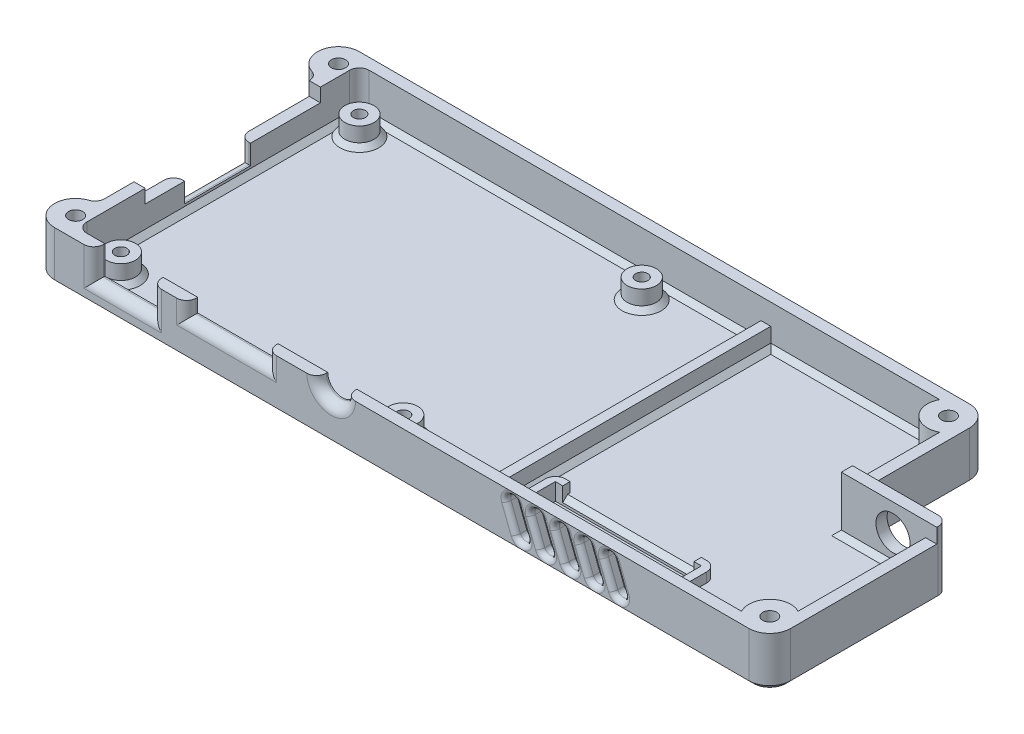
from build123d import *

# Parameters (mm, degrees)
BOSS_EXTRUDE1_DEPTH            = 10.3
BOSS_EXTRUDE2_DEPTH            = 2
SKETCH6_R                      = 3
BOSS_EXTRUDE3_DEPTH            = 4
F_2_5_2_5_DIAMETER_HOLE1_D     = 2.5
F_2_5_2_5_DIAMETER_HOLE1_DEPTH = 8
F_2_5_2_5_DIAMETER_HOLE1_TIP   = 0.751075774
SKETCH10_W                     = 2
SKETCH10_H                     = 58
BOSS_EXTRUDE4_DEPTH            = 4
CUT_EXTRUDE1_REACH             = 100.128
SKETCH11_R                     = 3
SKETCH11_W                     = 12
SKETCH11_H                     = 5.8
SKETCH11_W_2                   = 16.5
SKETCH11_H_2                   = 2.8
CUT_EXTRUDE2_REACH             = 153.227
SKETCH12_W                     = 13.5
SKETCH12_H                     = 6.8
SKETCH12_W_2                   = 36
SKETCH12_H_2                   = 2.8
FILLET6_R                      = 2
FILLET8_R                      = 2
CHAMFER1_SIZE                  = 1
FILLET9_R                      = 2
SKETCH14_W                     = 19.6
SKETCH14_H                     = 2.3
BOSS_EXTRUDE5_DEPTH            = 3
CUT_EXTRUDE3_REACH             = 86.384
SKETCH13_R                     = 3.5
BOSS_EXTRUDE6_DEPTH            = 10.3
F_2_9_2_9_DIAMETER_HOLE2_D     = 2.9
F_2_9_2_9_DIAMETER_HOLE1_D     = 2.9
BOSS_EXTRUDE7_REACH            = 89.052
SKETCH24_R                     = 4.3
F_2_9_2_9_DIAMETER_HOLE3_D     = 2.9
F_2_9_2_9_DIAMETER_HOLE4_D     = 2.9
FILLET10_R                     = 4.3
FILLET16_R                     = 4.3
FILLET17_R                     = 2
FILLET18_R                     = 2
FILLET19_R                     = 2
SKETCH29_W                     = 30.1
SKETCH29_H                     = 10.25
CUT_EXTRUDE4_DEPTH             = 1.5
CUT_EXTRUDE4_DIRECTION_2_REACH = 89.052
BOSS_EXTRUDE8_DEPTH            = 2
CHAMFER3_SIZE                  = 1
FILLET20_R                     = 2
CUT_EXTRUDE5_REACH             = 103.795
CHAMFER5_SIZE                  = 1
FILLET21_R                     = 1


# Some blends are built 0.0001 mm under size
with BuildPart() as part:
    # Sketch3 → Boss-Extrude1 (new body)
    with BuildSketch(Plane(origin=(0, 0, 0), x_dir=(1, 0, 0), z_dir=(0, 1, 0))):
        Polygon((54.738233838, 8.405993834), (72.038233838, 8.405993834), (72.038233838, -28.194006166), (54.738233838, -28.194006166), (-74.861766162, -28.194006166), (-74.861766162, 34.405993834), (54.738233838, 34.405993834), align=None)
        Polygon((57.038233838, -25.894006166), (69.738233838, -25.894006166), (69.738233838, 6.105993834), (52.438233838, 6.105993834), (52.438233838, 32.105993834), (-72.561766162, 32.105993834), (-72.561766162, -25.894006166), (52.438233838, -25.894006166), align=None, mode=Mode.SUBTRACT)
    extrude(amount=BOSS_EXTRUDE1_DEPTH)

    # Sketch5 → Boss-Extrude2 (add)
    with BuildSketch(Plane(origin=(0, 0, 0), x_dir=(1, 0, 0), z_dir=(0, 1, 0))):
        Polygon((-72.561766162, 32.105993834), (52.438233838, 32.105993834), (52.438233838, 6.105993834), (69.738233838, 6.105993834), (69.738233838, -25.894006166), (50.438233838, -25.894006166), (-72.561766162, -25.894006166), align=None)
    extrude(amount=BOSS_EXTRUDE2_DEPTH)

    # Sketch6 → Boss-Extrude3 (add)
    with BuildSketch(Plane(origin=(0, 2, 0), x_dir=(1, 0, 0), z_dir=(0, 1, 0))):
        with Locations(Location((-68.061766162, 27.605993834, 0), (0, 0, 270))):
            Circle(SKETCH6_R)
        with Locations(Location((-68.061766162, -21.394006166, 0), (0, 0, 270))):
            Circle(SKETCH6_R)
        with Locations(Location((-10.061766162, -21.394006166, 0), (0, 0, 270))):
            Circle(SKETCH6_R)
        with Locations(Location((-10.061766162, 27.605993834, 0), (0, 0, 270))):
            Circle(SKETCH6_R)
    extrude(amount=BOSS_EXTRUDE3_DEPTH)

    # Ø2.5 (2.5) Diameter Hole1
    with Locations(Plane(origin=(0, 6, 0), x_dir=(1, 0, 0), z_dir=(0, 1, 0))):
        with Locations((-68.061766162, 27.605993834), (-10.061766162, 27.605993834), (-10.061766162, -21.394006166), (-68.061766162, -21.394006166)):
            Hole(F_2_5_2_5_DIAMETER_HOLE1_D / 2, depth=F_2_5_2_5_DIAMETER_HOLE1_DEPTH)
            with Locations((0, 0, -(F_2_5_2_5_DIAMETER_HOLE1_DEPTH + F_2_5_2_5_DIAMETER_HOLE1_TIP / 2))):  # 118° drill point
                Cone(0, F_2_5_2_5_DIAMETER_HOLE1_D / 2, F_2_5_2_5_DIAMETER_HOLE1_TIP, mode=Mode.SUBTRACT)

    # Sketch10 → Boss-Extrude4 (add)
    with BuildSketch(Plane(origin=(0, 2, 0), x_dir=(1, 0, 0), z_dir=(0, 1, 0))):
        with Locations((10.938233838, 3.105993834)):
            Rectangle(SKETCH10_W, SKETCH10_H)
    extrude(amount=BOSS_EXTRUDE4_DEPTH)

    # Sketch11 → Cut-Extrude1 (cut, up to next)
    with BuildSketch(Plane.XY.offset(28.194006166), mode=Mode.PRIVATE) as cut_extrude1_sk1:
        with Locations((-18.061766162, 10.3)):
            Circle(SKETCH11_R)
    cut_extrude1_tool1 = extrude(cut_extrude1_sk1.sketch, amount=-CUT_EXTRUDE1_REACH, mode=Mode.PRIVATE) & part.part
    # Sketch11 → Cut-Extrude1 (cut, up to next)
    with BuildSketch(Plane.XY.offset(28.194006166), mode=Mode.PRIVATE) as cut_extrude1_sk2:
        with Locations((-60.861766162, 7.4)):
            Rectangle(SKETCH11_W, SKETCH11_H)
    cut_extrude1_tool2 = extrude(cut_extrude1_sk2.sketch, amount=-CUT_EXTRUDE1_REACH, mode=Mode.PRIVATE) & part.part
    # Sketch11 → Cut-Extrude1 (cut, up to next)
    with BuildSketch(Plane.XY.offset(28.194006166), mode=Mode.PRIVATE) as cut_extrude1_sk3:
        with Locations((-39.527982648, 8.9)):
            Rectangle(SKETCH11_W_2, SKETCH11_H_2)
    cut_extrude1_tool3 = extrude(cut_extrude1_sk3.sketch, amount=-CUT_EXTRUDE1_REACH, mode=Mode.PRIVATE) & part.part
    add(cut_extrude1_tool1.solids().sort_by_distance((-18.061766, 10.3, 28.194006))[0], mode=Mode.SUBTRACT)
    add(cut_extrude1_tool2.solids().sort_by_distance((-60.861766, 7.4, 28.194006))[0], mode=Mode.SUBTRACT)
    add(cut_extrude1_tool3.solids().sort_by_distance((-39.527983, 8.9, 28.194006))[0], mode=Mode.SUBTRACT)

    # Sketch12 → Cut-Extrude2 (cut, up to next)
    with BuildSketch(Plane.ZY.offset(74.861766162), mode=Mode.PRIVATE) as cut_extrude2_sk1:
        with Locations((-2.982922372, 6.9)):
            Rectangle(SKETCH12_W, SKETCH12_H)
    cut_extrude2_tool1 = extrude(cut_extrude2_sk1.sketch, amount=-CUT_EXTRUDE2_REACH, mode=Mode.PRIVATE) & part.part
    # Sketch12 → Cut-Extrude2 (cut, up to next)
    with BuildSketch(Plane.ZY.offset(74.861766162), mode=Mode.PRIVATE) as cut_extrude2_sk2:
        with Locations((-6.105993834, 8.9)):
            Rectangle(SKETCH12_W_2, SKETCH12_H_2)
    cut_extrude2_tool2 = extrude(cut_extrude2_sk2.sketch, amount=-CUT_EXTRUDE2_REACH, mode=Mode.PRIVATE) & part.part
    add(cut_extrude2_tool1.solids().sort_by_distance((-74.861766, 6.9, -2.982922))[0], mode=Mode.SUBTRACT)
    add(cut_extrude2_tool2.solids().sort_by_distance((-74.861766, 8.9, -6.105994))[0], mode=Mode.SUBTRACT)

    # Fillet6
    fillet6_edges = [part.edges().sort_by_distance(p)[0] for p in [
        (52.438233838, 6.15, -32.105993834),
    ]]
    fillet(fillet6_edges, radius=FILLET6_R)

    # Fillet8
    fillet8_edges = [part.edges().sort_by_distance(p)[0] for p in [
        (-72.561766162, 6.15, -32.105993834),
        (-72.561766162, 6.15, 25.894006166),
    ]]
    fillet(fillet8_edges, radius=FILLET8_R)

    # Chamfer1
    chamfer1_edges = [part.edges().sort_by_distance(p)[0] for p in [
        (-68.061766162, 2, -30.605993834),
        (-68.061766162, 2, 18.394006166),
        (-10.061766162, 2, 18.394006166),
        (-10.061766162, 2, -30.605993834),
    ]]
    chamfer(chamfer1_edges, length=CHAMFER1_SIZE)

    # Chamfer2
    # the kernel refuses this chamfer: 1 mm, written as the material it adds along each edge
    with BuildSketch(Plane(origin=(69.738233838, 2, 25.894006166), x_dir=(0, 0.9996219169112968, 0.027495876610585623), z_dir=(-1, 0, 0))) as chamfer2_piece_1:
        with BuildLine():
            Line((1.028673195, 0), (-0.056547155, 1.027117794))
            Line((-0.056547155, 1.027117794), (-0.076539593, 1.026567876))
            ThreePointArc((-0.076539593, 1.026567876), (-0.034129227, 0.51339783), (-0.019992438, -0.000549918))
            Line((-0.019992438, -0.000549918), (0.000549918, -0.019992438))
            ThreePointArc((0.000549918, -0.019992438), (0.514497665, -0.00585565), (1.029223113, -0.019992438))
            Line((1.029223113, -0.019992438), (1.028673195, 0))
        make_face()
    extrude(amount=57.8)
    with BuildSketch(Plane(origin=(-70.561766162, 2, -32.105993834), x_dir=(0, -0.027495876610586296, 0.9996219169112968), z_dir=(1, 0, 0)), Plane(origin=(9.938233838, 2, 25.894006166), x_dir=(0, -0.027495876610586726, -0.9996219169112968), z_dir=(-1, 0, 0))) as chamfer2_piece_2:
        with BuildLine():
            Line((1.028673195, 0), (-0.056547155, -1.027117794))
            Line((-0.056547155, -1.027117794), (-0.076539593, -1.026567876))
            ThreePointArc((-0.076539593, -1.026567876), (-0.034129227, -0.51339783), (-0.019992438, 0.000549918))
            Line((-0.019992438, 0.000549918), (0.000549918, 0.019992438))
            ThreePointArc((0.000549918, 0.019992438), (0.514497665, 0.00585565), (1.029223113, 0.019992438))
            Line((1.029223113, 0.019992438), (1.028673195, 0))
        make_face()
    extrude(amount=80.5)
    with BuildSketch(Plane(origin=(9.938233838, 2, 25.894006166), x_dir=(-0.9996219169112968, -0.027495876610586247, 0), z_dir=(0, 0, -1))) as chamfer2_piece_3:
        with BuildLine():
            Line((1.028673195, 0), (-0.056547155, 1.027117794))
            Line((-0.056547155, 1.027117794), (-0.076539593, 1.026567876))
            ThreePointArc((-0.076539593, 1.026567876), (-0.034129227, 0.51339783), (-0.019992438, -0.000549918))
            Line((-0.019992438, -0.000549918), (0.000549918, -0.019992438))
            ThreePointArc((0.000549918, -0.019992438), (0.514497665, -0.00585565), (1.029223113, -0.019992438))
            Line((1.029223113, -0.019992438), (1.028673195, 0))
        make_face()
    extrude(amount=58)
    with BuildSketch(Plane(origin=(11.938233838, 2, -32.105993834), x_dir=(-0.027495876610585623, 0.9996219169112968, 0), z_dir=(0, 0, 1))) as chamfer2_piece_4:
        with BuildLine():
            Line((1.028673195, 0), (-0.056547155, -1.027117794))
            Line((-0.056547155, -1.027117794), (-0.076539593, -1.026567876))
            ThreePointArc((-0.076539593, -1.026567876), (-0.034129227, -0.51339783), (-0.019992438, 0.000549918))
            Line((-0.019992438, 0.000549918), (0.000549918, 0.019992438))
            ThreePointArc((0.000549918, 0.019992438), (0.514497665, 0.00585565), (1.029223113, 0.019992438))
            Line((1.029223113, 0.019992438), (1.028673195, 0))
        make_face()
    extrude(amount=58)
    with BuildSketch(Plane(origin=(11.938233838, 2, -32.105993834), x_dir=(0, 0.9996219169112968, -0.027495876610589075), z_dir=(1, 0, 0))) as chamfer2_piece_5:
        with BuildLine():
            Line((1.028673195, 0), (-0.056547155, 1.027117794))
            Line((-0.056547155, 1.027117794), (-0.076539593, 1.026567876))
            ThreePointArc((-0.076539593, 1.026567876), (-0.034129227, 0.51339783), (-0.019992438, -0.000549918))
            Line((-0.019992438, -0.000549918), (0.000549918, -0.019992438))
            ThreePointArc((0.000549918, -0.019992438), (0.514497665, -0.00585565), (1.029223113, -0.019992438))
            Line((1.029223113, -0.019992438), (1.028673195, 0))
        make_face()
    extrude(amount=38.5)
    with BuildSketch(Plane(origin=(50.438233838, 2, -30.105993834), x_dir=(0, 0, -1), z_dir=(-1, 0, 0))) as chamfer2_piece_6:
        with BuildLine():
            Line((0.971715729, 0.028284271), (2.028284271, -1.028284271))
            Line((2.028284271, -1.028284271), (2.048284271, -1.028284271))
            ThreePointArc((2.048284271, -1.028284271), (2.02, -0.514142136), (2.02, 0))
            Line((2.02, 0), (2, 0.02))
            ThreePointArc((2, 0.02), (1.485857864, 0.02), (0.971715729, 0.048284271))
            Line((0.971715729, 0.048284271), (0.971715729, 0.028284271))
        make_face()
    revolve(axis=Axis((50.438233838, 2, -30.105993834), (0, -1, 0)), revolution_arc=90)
    with BuildSketch(Plane(origin=(-72.561766162, 2, 23.894006166), x_dir=(0.9996219169112968, -0.027495876610586605, 0), z_dir=(0, 0, -1))) as chamfer2_piece_7:
        with BuildLine():
            Line((1.028673195, 0), (-0.056547155, -1.027117794))
            Line((-0.056547155, -1.027117794), (-0.076539593, -1.026567876))
            ThreePointArc((-0.076539593, -1.026567876), (-0.034129227, -0.51339783), (-0.019992438, 0.000549918))
            Line((-0.019992438, 0.000549918), (0.000549918, 0.019992438))
            ThreePointArc((0.000549918, 0.019992438), (0.514497665, 0.00585565), (1.029223113, 0.019992438))
            Line((1.029223113, 0.019992438), (1.028673195, 0))
        make_face()
    extrude(amount=54)
    with BuildSketch(Plane(origin=(-70.561766162, 2, -30.105993834), x_dir=(0, 0, -1), z_dir=(1, 0, 0))) as chamfer2_piece_8:
        with BuildLine():
            Line((0.971715729, -0.028284271), (2.028284271, 1.028284271))
            Line((2.028284271, 1.028284271), (2.048284271, 1.028284271))
            ThreePointArc((2.048284271, 1.028284271), (2.02, 0.514142136), (2.02, 0))
            Line((2.02, 0), (2, -0.02))
            ThreePointArc((2, -0.02), (1.485857864, -0.02), (0.971715729, -0.048284271))
            Line((0.971715729, -0.048284271), (0.971715729, -0.028284271))
        make_face()
    revolve(axis=Axis((-70.561766162, 2, -30.105993834), (0, 1, 0)), revolution_arc=90)
    with BuildSketch(Plane(origin=(-70.561766162, 2, 23.894006166), x_dir=(-1, 0, 0), z_dir=(0, 0, -1))) as chamfer2_piece_9:
        with BuildLine():
            Line((0.971715729, -0.028284271), (2.028284271, 1.028284271))
            Line((2.028284271, 1.028284271), (2.048284271, 1.028284271))
            ThreePointArc((2.048284271, 1.028284271), (2.02, 0.514142136), (2.02, 0))
            Line((2.02, 0), (2, -0.02))
            ThreePointArc((2, -0.02), (1.485857864, -0.02), (0.971715729, -0.048284271))
            Line((0.971715729, -0.048284271), (0.971715729, -0.028284271))
        make_face()
    revolve(axis=Axis((-70.561766162, 2, 23.894006166), (0, 1, 0)), revolution_arc=90)
    with BuildSketch(Plane(origin=(69.738233838, 2, -6.105993834), x_dir=(-0.9996219169112968, -0.02749587661058639, 0), z_dir=(0, 0, 1))) as chamfer2_piece_10:
        with BuildLine():
            Line((1.028673195, 0), (-0.056547155, -1.027117794))
            Line((-0.056547155, -1.027117794), (-0.076539593, -1.026567876))
            ThreePointArc((-0.076539593, -1.026567876), (-0.034129227, -0.51339783), (-0.019992438, 0.000549918))
            Line((-0.019992438, 0.000549918), (0.000549918, 0.019992438))
            ThreePointArc((0.000549918, 0.019992438), (0.514497665, 0.00585565), (1.029223113, 0.019992438))
            Line((1.029223113, 0.019992438), (1.028673195, 0))
        make_face()
    extrude(amount=32)
    with BuildSketch(Plane(origin=(52.438233838, 2, -6.105993834), x_dir=(0, -0.02749587661058627, 0.9996219169112968), z_dir=(1, 0, 0))) as chamfer2_piece_11:
        with BuildLine():
            Line((1.028673195, 0), (-0.056547155, -1.027117794))
            Line((-0.056547155, -1.027117794), (-0.076539593, -1.026567876))
            ThreePointArc((-0.076539593, -1.026567876), (-0.034129227, -0.51339783), (-0.019992438, 0.000549918))
            Line((-0.019992438, 0.000549918), (0.000549918, 0.019992438))
            ThreePointArc((0.000549918, 0.019992438), (0.514497665, 0.00585565), (1.029223113, 0.019992438))
            Line((1.029223113, 0.019992438), (1.028673195, 0))
        make_face()
    extrude(amount=17.3)
    with BuildSketch(Plane(origin=(52.438233838, 2, -30.105993834), x_dir=(-0.9996219169112968, -0.0274958766105862, 0), z_dir=(0, 0, 1))) as chamfer2_piece_12:
        with BuildLine():
            Line((1.028673195, 0), (-0.056547155, -1.027117794))
            Line((-0.056547155, -1.027117794), (-0.076539593, -1.026567876))
            ThreePointArc((-0.076539593, -1.026567876), (-0.034129227, -0.51339783), (-0.019992438, 0.000549918))
            Line((-0.019992438, 0.000549918), (0.000549918, 0.019992438))
            ThreePointArc((0.000549918, 0.019992438), (0.514497665, 0.00585565), (1.029223113, 0.019992438))
            Line((1.029223113, 0.019992438), (1.028673195, 0))
        make_face()
    extrude(amount=24)
    with BuildSketch(Plane(origin=(72.309916826, 2, 25.894006166), x_dir=(0, 0.9996219169112968, 0.027495876610585623), z_dir=(-1, 0, 0))) as chamfer2_piece_13a_section:
        with BuildLine():
            Line((1.028673195, 0), (-0.056547155, 1.027117794))
            Line((-0.056547155, 1.027117794), (-0.076539593, 1.026567876))
            ThreePointArc((-0.076539593, 1.026567876), (-0.034129227, 0.51339783), (-0.019992438, -0.000549918))
            Line((-0.019992438, -0.000549918), (0.000549918, -0.019992438))
            ThreePointArc((0.000549918, -0.019992438), (0.514497665, -0.00585565), (1.029223113, -0.019992438))
            Line((1.029223113, -0.019992438), (1.028673195, 0))
        make_face()
    chamfer2_piece_13a = extrude(amount=60.371682988, mode=Mode.PRIVATE)
    chamfer2_piece_13a = split(chamfer2_piece_13a, bisect_by=Plane(origin=(69.738233838, 2.329793627, 25.564212539), z_dir=(1, 0, 0)), keep=Keep.TOP, mode=Mode.PRIVATE)
    with BuildSketch(Plane(origin=(69.738233838, 2, -6.105993834), x_dir=(-0.9996219169112968, -0.02749587661058639, 0), z_dir=(0, 0, 1))) as chamfer2_piece_13b_section:
        with BuildLine():
            Line((1.028673195, 0), (-0.056547155, -1.027117794))
            Line((-0.056547155, -1.027117794), (-0.076539593, -1.026567876))
            ThreePointArc((-0.076539593, -1.026567876), (-0.034129227, -0.51339783), (-0.019992438, 0.000549918))
            Line((-0.019992438, 0.000549918), (0.000549918, 0.019992438))
            ThreePointArc((0.000549918, 0.019992438), (0.514497665, 0.00585565), (1.029223113, 0.019992438))
            Line((1.029223113, 0.019992438), (1.028673195, 0))
        make_face()
    chamfer2_piece_13b = extrude(amount=34.571682988, mode=Mode.PRIVATE)
    chamfer2_piece_13b = split(chamfer2_piece_13b, bisect_by=Plane(origin=(69.408440211, 2.329793627, 25.894006166), z_dir=(0, 0, 1)), keep=Keep.TOP, mode=Mode.PRIVATE)
    chamfer2_piece_13 = chamfer2_piece_13a & chamfer2_piece_13b
    add(chamfer2_piece_13)
    with BuildSketch(Plane(origin=(69.738233838, 2, 25.894006166), x_dir=(0, 0.9996219169112968, 0.027495876610585623), z_dir=(-1, 0, 0))) as chamfer2_piece_14a_section:
        with BuildLine():
            Line((1.028673195, 0), (-0.056547155, 1.027117794))
            Line((-0.056547155, 1.027117794), (-0.076539593, 1.026567876))
            ThreePointArc((-0.076539593, 1.026567876), (-0.034129227, 0.51339783), (-0.019992438, -0.000549918))
            Line((-0.019992438, -0.000549918), (0.000549918, -0.019992438))
            ThreePointArc((0.000549918, -0.019992438), (0.514497665, -0.00585565), (1.029223113, -0.019992438))
            Line((1.029223113, -0.019992438), (1.028673195, 0))
        make_face()
    chamfer2_piece_14a = extrude(amount=60.371682988, mode=Mode.PRIVATE)
    chamfer2_piece_14a = split(chamfer2_piece_14a, bisect_by=Plane(origin=(11.938233838, 2.329793627, 25.564212539), z_dir=(-1, 0, 0)), keep=Keep.TOP, mode=Mode.PRIVATE)
    with BuildSketch(Plane(origin=(11.938233838, 2, -32.105993834), x_dir=(-0.027495876610585623, 0.9996219169112968, 0), z_dir=(0, 0, 1))) as chamfer2_piece_14b_section:
        with BuildLine():
            Line((1.028673195, 0), (-0.056547155, -1.027117794))
            Line((-0.056547155, -1.027117794), (-0.076539593, -1.026567876))
            ThreePointArc((-0.076539593, -1.026567876), (-0.034129227, -0.51339783), (-0.019992438, 0.000549918))
            Line((-0.019992438, 0.000549918), (0.000549918, 0.019992438))
            ThreePointArc((0.000549918, 0.019992438), (0.514497665, 0.00585565), (1.029223113, 0.019992438))
            Line((1.029223113, 0.019992438), (1.028673195, 0))
        make_face()
    chamfer2_piece_14b = extrude(amount=60.571682988, mode=Mode.PRIVATE)
    chamfer2_piece_14b = split(chamfer2_piece_14b, bisect_by=Plane(origin=(12.268027465, 2.329793627, 25.894006166), z_dir=(0, 0, 1)), keep=Keep.TOP, mode=Mode.PRIVATE)
    chamfer2_piece_14 = chamfer2_piece_14a & chamfer2_piece_14b
    add(chamfer2_piece_14)
    with BuildSketch(Plane(origin=(-70.561766162, 2, -32.105993834), x_dir=(0, -0.027495876610586296, 0.9996219169112968), z_dir=(1, 0, 0))) as chamfer2_piece_15a_section:
        with BuildLine():
            Line((1.028673195, 0), (-0.056547155, -1.027117794))
            Line((-0.056547155, -1.027117794), (-0.076539593, -1.026567876))
            ThreePointArc((-0.076539593, -1.026567876), (-0.034129227, -0.51339783), (-0.019992438, 0.000549918))
            Line((-0.019992438, 0.000549918), (0.000549918, 0.019992438))
            ThreePointArc((0.000549918, 0.019992438), (0.514497665, 0.00585565), (1.029223113, 0.019992438))
            Line((1.029223113, 0.019992438), (1.028673195, 0))
        make_face()
    chamfer2_piece_15a = extrude(amount=83.071682988, mode=Mode.PRIVATE)
    chamfer2_piece_15a = split(chamfer2_piece_15a, bisect_by=Plane(origin=(9.938233838, 2.329793627, -31.776200208), z_dir=(1, 0, 0)), keep=Keep.TOP, mode=Mode.PRIVATE)
    with BuildSketch(Plane(origin=(9.938233838, 2, 25.894006166), x_dir=(-0.9996219169112968, -0.027495876610586247, 0), z_dir=(0, 0, -1))) as chamfer2_piece_15b_section:
        with BuildLine():
            Line((1.028673195, 0), (-0.056547155, 1.027117794))
            Line((-0.056547155, 1.027117794), (-0.076539593, 1.026567876))
            ThreePointArc((-0.076539593, 1.026567876), (-0.034129227, 0.51339783), (-0.019992438, -0.000549918))
            Line((-0.019992438, -0.000549918), (0.000549918, -0.019992438))
            ThreePointArc((0.000549918, -0.019992438), (0.514497665, -0.00585565), (1.029223113, -0.019992438))
            Line((1.029223113, -0.019992438), (1.028673195, 0))
        make_face()
    chamfer2_piece_15b = extrude(amount=60.571682988, mode=Mode.PRIVATE)
    chamfer2_piece_15b = split(chamfer2_piece_15b, bisect_by=Plane(origin=(9.608440211, 2.329793627, -32.105993834), z_dir=(0, 0, -1)), keep=Keep.TOP, mode=Mode.PRIVATE)
    chamfer2_piece_15 = chamfer2_piece_15a & chamfer2_piece_15b
    add(chamfer2_piece_15)
    with BuildSketch(Plane(origin=(12.509916826, 2, 25.894006166), x_dir=(0, -0.027495876610586296, -0.9996219169112968), z_dir=(-1, 0, 0))) as chamfer2_piece_16a_section:
        with BuildLine():
            Line((1.028673195, 0), (-0.056547155, -1.027117794))
            Line((-0.056547155, -1.027117794), (-0.076539593, -1.026567876))
            ThreePointArc((-0.076539593, -1.026567876), (-0.034129227, -0.51339783), (-0.019992438, 0.000549918))
            Line((-0.019992438, 0.000549918), (0.000549918, 0.019992438))
            ThreePointArc((0.000549918, 0.019992438), (0.514497665, 0.00585565), (1.029223113, 0.019992438))
            Line((1.029223113, 0.019992438), (1.028673195, 0))
        make_face()
    chamfer2_piece_16a = extrude(amount=83.071682988, mode=Mode.PRIVATE)
    chamfer2_piece_16a = split(chamfer2_piece_16a, bisect_by=Plane(origin=(9.938233838, 2.329793627, 25.564212539), z_dir=(1, 0, 0)), keep=Keep.TOP, mode=Mode.PRIVATE)
    with BuildSketch(Plane(origin=(9.938233838, 2, 28.465689154), x_dir=(-0.9996219169112968, -0.027495876610586296, 0), z_dir=(0, 0, -1))) as chamfer2_piece_16b_section:
        with BuildLine():
            Line((1.028673195, 0), (-0.056547155, 1.027117794))
            Line((-0.056547155, 1.027117794), (-0.076539593, 1.026567876))
            ThreePointArc((-0.076539593, 1.026567876), (-0.034129227, 0.51339783), (-0.019992438, -0.000549918))
            Line((-0.019992438, -0.000549918), (0.000549918, -0.019992438))
            ThreePointArc((0.000549918, -0.019992438), (0.514497665, -0.00585565), (1.029223113, -0.019992438))
            Line((1.029223113, -0.019992438), (1.028673195, 0))
        make_face()
    chamfer2_piece_16b = extrude(amount=60.571682988, mode=Mode.PRIVATE)
    chamfer2_piece_16b = split(chamfer2_piece_16b, bisect_by=Plane(origin=(9.608440211, 2.329793627, 25.894006166), z_dir=(0, 0, 1)), keep=Keep.TOP, mode=Mode.PRIVATE)
    chamfer2_piece_16 = chamfer2_piece_16a & chamfer2_piece_16b
    add(chamfer2_piece_16)
    with BuildSketch(Plane(origin=(9.36655085, 2, -32.105993834), x_dir=(0, 0.9996219169112968, -0.027495876610589075), z_dir=(1, 0, 0))) as chamfer2_piece_17a_section:
        with BuildLine():
            Line((1.028673195, 0), (-0.056547155, 1.027117794))
            Line((-0.056547155, 1.027117794), (-0.076539593, 1.026567876))
            ThreePointArc((-0.076539593, 1.026567876), (-0.034129227, 0.51339783), (-0.019992438, -0.000549918))
            Line((-0.019992438, -0.000549918), (0.000549918, -0.019992438))
            ThreePointArc((0.000549918, -0.019992438), (0.514497665, -0.00585565), (1.029223113, -0.019992438))
            Line((1.029223113, -0.019992438), (1.028673195, 0))
        make_face()
    chamfer2_piece_17a = extrude(amount=41.071682988, mode=Mode.PRIVATE)
    chamfer2_piece_17a = split(chamfer2_piece_17a, bisect_by=Plane(origin=(11.938233838, 2.329793627, -31.776200208), z_dir=(-1, 0, 0)), keep=Keep.TOP, mode=Mode.PRIVATE)
    with BuildSketch(Plane(origin=(11.938233838, 2, -34.677676822), x_dir=(-0.027495876610585623, 0.9996219169112968, 0), z_dir=(0, 0, 1))) as chamfer2_piece_17b_section:
        with BuildLine():
            Line((1.028673195, 0), (-0.056547155, -1.027117794))
            Line((-0.056547155, -1.027117794), (-0.076539593, -1.026567876))
            ThreePointArc((-0.076539593, -1.026567876), (-0.034129227, -0.51339783), (-0.019992438, 0.000549918))
            Line((-0.019992438, 0.000549918), (0.000549918, 0.019992438))
            ThreePointArc((0.000549918, 0.019992438), (0.514497665, 0.00585565), (1.029223113, 0.019992438))
            Line((1.029223113, 0.019992438), (1.028673195, 0))
        make_face()
    chamfer2_piece_17b = extrude(amount=60.571682988, mode=Mode.PRIVATE)
    chamfer2_piece_17b = split(chamfer2_piece_17b, bisect_by=Plane(origin=(12.268027465, 2.329793627, -32.105993834), z_dir=(0, 0, -1)), keep=Keep.TOP, mode=Mode.PRIVATE)
    chamfer2_piece_17 = chamfer2_piece_17a & chamfer2_piece_17b
    add(chamfer2_piece_17)
    with BuildSketch(Plane(origin=(52.438233838, 2, -6.105993834), x_dir=(0, -0.02749587661058627, 0.9996219169112968), z_dir=(1, 0, 0))) as chamfer2_piece_18a_section:
        with BuildLine():
            Line((1.028673195, 0), (-0.056547155, -1.027117794))
            Line((-0.056547155, -1.027117794), (-0.076539593, -1.026567876))
            ThreePointArc((-0.076539593, -1.026567876), (-0.034129227, -0.51339783), (-0.019992438, 0.000549918))
            Line((-0.019992438, 0.000549918), (0.000549918, 0.019992438))
            ThreePointArc((0.000549918, 0.019992438), (0.514497665, 0.00585565), (1.029223113, 0.019992438))
            Line((1.029223113, 0.019992438), (1.028673195, 0))
        make_face()
    chamfer2_piece_18a = extrude(amount=19.871682988, mode=Mode.PRIVATE)
    chamfer2_piece_18a = split(chamfer2_piece_18a, bisect_by=Plane(origin=(69.738233838, 2.329793627, -5.776200208), z_dir=(1, 0, 0)), keep=Keep.TOP, mode=Mode.PRIVATE)
    with BuildSketch(Plane(origin=(69.738233838, 2, -8.677676822), x_dir=(-0.9996219169112968, -0.02749587661058639, 0), z_dir=(0, 0, 1))) as chamfer2_piece_18b_section:
        with BuildLine():
            Line((1.028673195, 0), (-0.056547155, -1.027117794))
            Line((-0.056547155, -1.027117794), (-0.076539593, -1.026567876))
            ThreePointArc((-0.076539593, -1.026567876), (-0.034129227, -0.51339783), (-0.019992438, 0.000549918))
            Line((-0.019992438, 0.000549918), (0.000549918, 0.019992438))
            ThreePointArc((0.000549918, 0.019992438), (0.514497665, 0.00585565), (1.029223113, 0.019992438))
            Line((1.029223113, 0.019992438), (1.028673195, 0))
        make_face()
    chamfer2_piece_18b = extrude(amount=34.571682988, mode=Mode.PRIVATE)
    chamfer2_piece_18b = split(chamfer2_piece_18b, bisect_by=Plane(origin=(69.408440211, 2.329793627, -6.105993834), z_dir=(0, 0, -1)), keep=Keep.TOP, mode=Mode.PRIVATE)
    chamfer2_piece_18 = chamfer2_piece_18a & chamfer2_piece_18b
    add(chamfer2_piece_18)
    with BuildSketch(Plane(origin=(52.438233838, 2, -30.105993834), x_dir=(-0.9996219169112968, -0.0274958766105862, 0), z_dir=(0, 0, 1))) as chamfer2_piece_19a_section:
        with BuildLine():
            Line((1.028673195, 0), (-0.056547155, -1.027117794))
            Line((-0.056547155, -1.027117794), (-0.076539593, -1.026567876))
            ThreePointArc((-0.076539593, -1.026567876), (-0.034129227, -0.51339783), (-0.019992438, 0.000549918))
            Line((-0.019992438, 0.000549918), (0.000549918, 0.019992438))
            ThreePointArc((0.000549918, 0.019992438), (0.514497665, 0.00585565), (1.029223113, 0.019992438))
            Line((1.029223113, 0.019992438), (1.028673195, 0))
        make_face()
    chamfer2_piece_19a = extrude(amount=26.571682988, mode=Mode.PRIVATE)
    chamfer2_piece_19a = split(chamfer2_piece_19a, bisect_by=Plane(origin=(52.108440211, 2.329793627, -6.105993834), z_dir=(0, 0, 1)), keep=Keep.TOP, mode=Mode.PRIVATE)
    with BuildSketch(Plane(origin=(49.86655085, 2, -6.105993834), x_dir=(0, -0.02749587661058627, 0.9996219169112968), z_dir=(1, 0, 0))) as chamfer2_piece_19b_section:
        with BuildLine():
            Line((1.028673195, 0), (-0.056547155, -1.027117794))
            Line((-0.056547155, -1.027117794), (-0.076539593, -1.026567876))
            ThreePointArc((-0.076539593, -1.026567876), (-0.034129227, -0.51339783), (-0.019992438, 0.000549918))
            Line((-0.019992438, 0.000549918), (0.000549918, 0.019992438))
            ThreePointArc((0.000549918, 0.019992438), (0.514497665, 0.00585565), (1.029223113, 0.019992438))
            Line((1.029223113, 0.019992438), (1.028673195, 0))
        make_face()
    chamfer2_piece_19b = extrude(amount=19.871682988, mode=Mode.PRIVATE)
    chamfer2_piece_19b = split(chamfer2_piece_19b, bisect_by=Plane(origin=(52.438233838, 2.329793627, -5.776200208), z_dir=(-1, 0, 0)), keep=Keep.TOP, mode=Mode.PRIVATE)
    chamfer2_piece_19 = chamfer2_piece_19a & chamfer2_piece_19b
    add(chamfer2_piece_19)

    # Fillet9
    fillet9_edges = [part.edges().sort_by_distance(p)[0] for p in [
        (-60.861766162, 4.5, 28.194006166),
        (-54.861766162, 7.4, 28.194006166),
        (-47.777982648, 8.9, 28.194006166),
        (-39.527982648, 7.5, 28.194006166),
        (-31.277982648, 8.9, 28.194006166),
        (-18.061766162, 7.3, 28.194006166),
        (-74.861766162, 5.5, -9.732922372),
        (-74.861766162, 3.5, -2.982922372),
        (-74.861766162, 5.5, 3.767077628),
    ]]
    fillet(fillet9_edges, radius=FILLET9_R)

    # Sketch14 → Boss-Extrude5 (add)
    with BuildSketch(Plane(origin=(0, 10.3, 0), x_dir=(1, 0, 0), z_dir=(0, 1, 0))):
        with Locations((62.238233838, 7.255993834)):
            Rectangle(SKETCH14_W, SKETCH14_H)
    extrude(amount=BOSS_EXTRUDE5_DEPTH)

    # Sketch13 → Cut-Extrude3 (cut, up to next)
    with BuildSketch(Plane(origin=(0, 0, -8.405993834), x_dir=(-1, 0, 0), z_dir=(0, 0, -1)), mode=Mode.PRIVATE) as cut_extrude3_sk1:
        with Locations((-63.038233838, 7.76206837)):
            Circle(SKETCH13_R)
    cut_extrude3_tool1 = extrude(cut_extrude3_sk1.sketch, amount=-CUT_EXTRUDE3_REACH, mode=Mode.PRIVATE) & part.part
    add(cut_extrude3_tool1.solids().sort_by_distance((63.038234, 7.762068, -8.405994))[0], mode=Mode.SUBTRACT)

    # Sketch17 → Boss-Extrude6 (add)
    with BuildSketch(Plane(origin=(0, 0, 0), x_dir=(1, 0, 0), z_dir=(0, 1, 0))):
        with BuildLine():
            Line((-74.861766162, 34.405993834), (-74.861766162, 25.805993834))
            ThreePointArc((-74.861766162, 25.805993834), (-79.161766162, 30.105993834), (-74.861766162, 34.405993834))
        make_face()
        with BuildLine():
            Line((-74.861766162, -19.594006166), (-74.861766162, -28.194006166))
            ThreePointArc((-74.861766162, -28.194006166), (-79.161766162, -23.894006166), (-74.861766162, -19.594006166))
        make_face()
    extrude(amount=BOSS_EXTRUDE6_DEPTH)

    # Ø2.9 (2.9) Diameter Hole2 (through all)
    with Locations(Plane(origin=(0, 10.3, 0), x_dir=(1, 0, 0), z_dir=(0, 1, 0))):
        with Locations((-74.861766162, 30.105993834)):
            Hole(F_2_9_2_9_DIAMETER_HOLE2_D / 2)

    # Ø2.9 (2.9) Diameter Hole1 (through all)
    with Locations(Plane(origin=(0, 10.3, 0), x_dir=(1, 0, 0), z_dir=(0, 1, 0))):
        with Locations((-74.861766162, -23.894006166)):
            Hole(F_2_9_2_9_DIAMETER_HOLE1_D / 2)

    # Boss-Extrude7: up to this face of the body (flat: up to its plane)
    boss_extrude7_end = Plane(part.part.faces().sort_by_distance((-74.050055774, 10.3, 22.517680386))[0])
    # Sketch24 → Boss-Extrude7 (add, up to the picked face)
    with BuildSketch(Plane(origin=(0, 2, 0), x_dir=(1, 0, 0), z_dir=(0, 1, 0)), mode=Mode.PRIVATE) as boss_extrude7_sk1:
        with Locations((67.738233838, -23.894006166)):
            Circle(SKETCH24_R)
    boss_extrude7_tool1 = split(extrude(boss_extrude7_sk1.sketch, amount=BOSS_EXTRUDE7_REACH, mode=Mode.PRIVATE), bisect_by=boss_extrude7_end, keep=Keep.BOTH, mode=Mode.PRIVATE)
    # Sketch24 → Boss-Extrude7 (add, up to the picked face)
    with BuildSketch(Plane(origin=(0, 2, 0), x_dir=(1, 0, 0), z_dir=(0, 1, 0)), mode=Mode.PRIVATE) as boss_extrude7_sk2:
        with Locations((50.438233838, 30.105993834)):
            Circle(SKETCH24_R)
    boss_extrude7_tool2 = split(extrude(boss_extrude7_sk2.sketch, amount=BOSS_EXTRUDE7_REACH, mode=Mode.PRIVATE), bisect_by=boss_extrude7_end, keep=Keep.BOTH, mode=Mode.PRIVATE)
    add(boss_extrude7_tool1.solids().sort_by(Axis((67.738234, 2, 23.894006), (0, 1, 0)))[0])
    add(boss_extrude7_tool2.solids().sort_by(Axis((50.438234, 2, -30.105994), (0, 1, 0)))[0])

    # Ø2.9 (2.9) Diameter Hole3 (through all)
    with Locations(Plane(origin=(0, 10.3, 0), x_dir=(1, 0, 0), z_dir=(0, 1, 0))):
        with Locations((67.738233838, -23.894006166)):
            Hole(F_2_9_2_9_DIAMETER_HOLE3_D / 2)

    # Ø2.9 (2.9) Diameter Hole4 (through all)
    with Locations(Plane(origin=(0, 10.3, 0), x_dir=(1, 0, 0), z_dir=(0, 1, 0))):
        with Locations((50.438233838, 30.105993834)):
            Hole(F_2_9_2_9_DIAMETER_HOLE4_D / 2)

    # Fillet10
    fillet10_edges = [part.edges().sort_by_distance(p)[0] for p in [
        (54.738233838, 5.15, -34.405993834),
    ]]
    fillet(fillet10_edges, radius=FILLET10_R - 0.0001)  # a hair under: the kernel refuses the full size

    # Fillet16
    fillet16_edges = [part.edges().sort_by_distance(p)[0] for p in [
        (72.038233838, 5.15, 28.194006166),
    ]]
    fillet(fillet16_edges, radius=FILLET16_R - 0.0001)  # a hair under: the kernel refuses the full size

    # Fillet17
    fillet17_edges = [part.edges().sort_by_distance(p)[0] for p in [
        (54.738233838, 5.15, -8.405993834),
        (72.038233838, 6.65, -8.405993834),
    ]]
    fillet(fillet17_edges, radius=FILLET17_R)

    # Fillet18
    fillet18_edges = [part.edges().sort_by_distance(p)[0] for p in [
        (-74.861766162, 5.15, -25.805993834),
        (-74.861766162, 5.15, 19.594006166),
    ]]
    fillet(fillet18_edges, radius=FILLET18_R)

    # Fillet19
    fillet19_edges = [part.edges().sort_by_distance(p)[0] for p in [
        (-66.861766162, 6.4, 28.194006166),
    ]]
    fillet(fillet19_edges, radius=FILLET19_R)

    # Sketch29 → Cut-Extrude4 (cut)
    with BuildSketch(Plane(origin=(0, 2, 0), x_dir=(1, 0, 0), z_dir=(0, 1, 0))):
        with Locations((30.488233838, -20.769006166)):
            Rectangle(SKETCH29_W, SKETCH29_H)
    extrude(amount=-CUT_EXTRUDE4_DEPTH, mode=Mode.SUBTRACT)

    # Sketch29 → Cut-Extrude4 direction 2 (cut, up to next)
    with BuildSketch(Plane(origin=(0, 2, 0), x_dir=(1, 0, 0), z_dir=(0, 1, 0)), mode=Mode.PRIVATE) as cut_extrude4_direction_2_sk1:
        with Locations((30.488233838, -20.769006166)):
            Rectangle(SKETCH29_W, SKETCH29_H)
    cut_extrude4_direction_2_tool1 = extrude(cut_extrude4_direction_2_sk1.sketch, amount=CUT_EXTRUDE4_DIRECTION_2_REACH, mode=Mode.PRIVATE) & part.part
    add(cut_extrude4_direction_2_tool1.solids().sort_by_distance((30.488234, 2, 20.769006))[0], mode=Mode.SUBTRACT)

    # Sketch30 → Boss-Extrude8 (add)
    with BuildSketch(Plane(origin=(0, 2, 0), x_dir=(1, 0, 0), z_dir=(0, 1, 0))):
        Polygon((13.938233838, -25.908422091), (15.438233838, -25.894006166), (15.438233838, -15.644006166), (16.959333041, -15.644006166), (16.959333041, -14.144006166), (13.938233838, -14.144006166), align=None)
        Polygon((45.438233838, -15.644006166), (45.438233838, -25.894006166), (47.038233838, -25.894006166), (47.038233838, -14.144006166), (43.917134635, -14.144006166), (43.917134635, -15.644006166), align=None)
    extrude(amount=BOSS_EXTRUDE8_DEPTH)

    # Chamfer3
    chamfer3_edges = [part.edges().sort_by_distance(p)[0] for p in [
        (30.438233838, 2, 15.644006166),
    ]]
    chamfer(chamfer3_edges, length=CHAMFER3_SIZE)

    # Fillet20
    fillet20_edges = [part.edges().sort_by_distance(p)[0] for p in [
        (13.938233838, 3, 14.144006166),
        (47.038233838, 3, 14.144006166),
    ]]
    fillet(fillet20_edges, radius=FILLET20_R)

    # Sketch31 → Cut-Extrude5 (cut, up to next)
    with BuildSketch(Plane.XY.offset(28.194006166), mode=Mode.PRIVATE) as cut_extrude5_sk1:
        with BuildLine():
            Line((20.245745407, 8.572350221), (22.162062151, 3.630920252))
            ThreePointArc((22.162062151, 3.630920252), (21.448592051, 2.01352716), (19.831198958, 2.72699726))
            Line((19.831198958, 2.72699726), (17.914882214, 7.668427229))
            ThreePointArc((17.914882214, 7.668427229), (18.628352315, 9.285820322), (20.245745407, 8.572350221))
        make_face()
    cut_extrude5_tool1 = extrude(cut_extrude5_sk1.sketch, amount=-CUT_EXTRUDE5_REACH, mode=Mode.PRIVATE) & part.part
    # Sketch31 → Cut-Extrude5 (cut, up to next)
    with BuildSketch(Plane.XY.offset(28.194006166), mode=Mode.PRIVATE) as cut_extrude5_sk2:
        with BuildLine():
            Line((25.245745407, 8.572350221), (27.162062151, 3.630920252))
            ThreePointArc((27.162062151, 3.630920252), (26.448592051, 2.01352716), (24.831198958, 2.72699726))
            Line((24.831198958, 2.72699726), (22.914882214, 7.668427229))
            ThreePointArc((22.914882214, 7.668427229), (23.628352315, 9.285820322), (25.245745407, 8.572350221))
        make_face()
    cut_extrude5_tool2 = extrude(cut_extrude5_sk2.sketch, amount=-CUT_EXTRUDE5_REACH, mode=Mode.PRIVATE) & part.part
    # Sketch31 → Cut-Extrude5 (cut, up to next)
    with BuildSketch(Plane.XY.offset(28.194006166), mode=Mode.PRIVATE) as cut_extrude5_sk3:
        with BuildLine():
            Line((30.245745407, 8.572350221), (32.162062151, 3.630920252))
            ThreePointArc((32.162062151, 3.630920252), (31.448592051, 2.01352716), (29.831198958, 2.72699726))
            Line((29.831198958, 2.72699726), (27.914882214, 7.668427229))
            ThreePointArc((27.914882214, 7.668427229), (28.628352315, 9.285820322), (30.245745407, 8.572350221))
        make_face()
    cut_extrude5_tool3 = extrude(cut_extrude5_sk3.sketch, amount=-CUT_EXTRUDE5_REACH, mode=Mode.PRIVATE) & part.part
    # Sketch31 → Cut-Extrude5 (cut, up to next)
    with BuildSketch(Plane.XY.offset(28.194006166), mode=Mode.PRIVATE) as cut_extrude5_sk4:
        with BuildLine():
            Line((35.245745407, 8.572350221), (37.162062151, 3.630920252))
            ThreePointArc((37.162062151, 3.630920252), (36.448592051, 2.01352716), (34.831198958, 2.72699726))
            Line((34.831198958, 2.72699726), (32.914882214, 7.668427229))
            ThreePointArc((32.914882214, 7.668427229), (33.628352315, 9.285820322), (35.245745407, 8.572350221))
        make_face()
    cut_extrude5_tool4 = extrude(cut_extrude5_sk4.sketch, amount=-CUT_EXTRUDE5_REACH, mode=Mode.PRIVATE) & part.part
    # Sketch31 → Cut-Extrude5 (cut, up to next)
    with BuildSketch(Plane.XY.offset(28.194006166), mode=Mode.PRIVATE) as cut_extrude5_sk5:
        with BuildLine():
            Line((40.245745407, 8.572350221), (42.162062151, 3.630920252))
            ThreePointArc((42.162062151, 3.630920252), (41.448592051, 2.01352716), (39.831198958, 2.72699726))
            Line((39.831198958, 2.72699726), (37.914882214, 7.668427229))
            ThreePointArc((37.914882214, 7.668427229), (38.628352315, 9.285820322), (40.245745407, 8.572350221))
        make_face()
    cut_extrude5_tool5 = extrude(cut_extrude5_sk5.sketch, amount=-CUT_EXTRUDE5_REACH, mode=Mode.PRIVATE) & part.part
    add(cut_extrude5_tool1.solids().sort_by_distance((20.038472, 5.649674, 28.194006))[0], mode=Mode.SUBTRACT)
    add(cut_extrude5_tool2.solids().sort_by_distance((25.038472, 5.649674, 28.194006))[0], mode=Mode.SUBTRACT)
    add(cut_extrude5_tool3.solids().sort_by_distance((30.038472, 5.649674, 28.194006))[0], mode=Mode.SUBTRACT)
    add(cut_extrude5_tool4.solids().sort_by_distance((35.038472, 5.649674, 28.194006))[0], mode=Mode.SUBTRACT)
    add(cut_extrude5_tool5.solids().sort_by_distance((40.038472, 5.649674, 28.194006))[0], mode=Mode.SUBTRACT)

    # Chamfer5
    chamfer5_edges = [part.edges().sort_by_distance(p)[0] for p in [
        (-79.105793795, 0, -30.797535193),
        (-12.211716162, 0, -34.405993834),
        (53.478822286, 0, -33.146582283),
        (72.038233838, 0, 8.744056166),
        (70.778822286, 0, 26.934594614),
        (54.738233838, 0, -20.256043834),
        (63.388233838, 0, -8.405993834),
        (71.4524474, 0, -7.820207397),
        (55.324020275, 0, -8.991780272),
        (-79.105793795, 0, 24.585547524),
        (-74.861766162, 0, -3.105993834),
        (-75.2385223, 0, 19.088261462),
        (-75.2385223, 0, -25.300249131),
        (-3.561716162, 0, 28.194006166),
    ]]
    chamfer(chamfer5_edges, length=CHAMFER5_SIZE)

    # Fillet21
    # the kernel refuses this fillet: 1 mm, written as the material it takes off along each edge
    with BuildSketch(Plane(origin=(19.080313811, 8.120388725, 28.194006166), x_dir=(-0.9323452771444887, -0.3615691969545617, 0), z_dir=(0.3615691969545617, -0.9323452771444887, 0))) as fillet21_piece_1:
        with BuildLine():
            CenterArc((1.25 + FILLET21_R, FILLET21_R), FILLET21_R, 180, 90)
            Line((1.25, FILLET21_R), (1.25, 0))
            Line((1.25, 0), (1.25 + FILLET21_R, 0))
        make_face()
    revolve(axis=Axis((19.080313811, 8.120388725, 28.194006166), (0, 0, -1)), revolution_arc=180, mode=Mode.SUBTRACT)
    with BuildSketch(Plane(origin=(19.831198958, 2.72699726, 28.194006166), x_dir=(-0.9323452771444882, -0.361569196954563, 7.105427357600977e-15), z_dir=(-0.361569196954563, 0.9323452771444882, 0)), Plane(origin=(20.245745407, 8.572350221, 28.194006166), x_dir=(0.9323452771444893, 0.36156919695456025, 7.10542735760103e-15), z_dir=(0.36156919695456025, -0.9323452771444892, 0)), Plane(origin=(24.831198958, 2.72699726, 28.194006166), x_dir=(-0.932345277144489, -0.3615691969545611, 7.105427357600981e-15), z_dir=(-0.36156919695456113, 0.932345277144489, 0)), Plane(origin=(25.245745407, 8.572350221, 28.194006166), x_dir=(0.9323452771444893, 0.36156919695456025, 1.0658141036401545e-14), z_dir=(0.36156919695456025, -0.9323452771444892, 0)), Plane(origin=(29.831198958, 2.72699726, 28.194006166), x_dir=(-0.9323452771444894, -0.3615691969545597, 1.0658141036401478e-14), z_dir=(-0.3615691969545597, 0.9323452771444894, 0)), Plane(origin=(30.245745407, 8.572350221, 28.194006166), x_dir=(0.9323452771444887, 0.36156919695456163, 1.0658141036401572e-14), z_dir=(0.36156919695456163, -0.9323452771444887, 0)), Plane(origin=(34.831198958, 2.72699726, 28.194006166), x_dir=(-0.9323452771444888, -0.3615691969545616, 1.421085471520196e-14), z_dir=(-0.3615691969545616, 0.9323452771444888, 0)), Plane(origin=(35.245745407, 8.572350221, 28.194006166), x_dir=(0.9323452771444889, 0.36156919695456163, 1.421085471520196e-14), z_dir=(0.3615691969545616, -0.9323452771444888, 0)), Plane(origin=(39.831198958, 2.72699726, 28.194006166), x_dir=(-0.9323452771444887, -0.3615691969545618, 1.421085471520196e-14), z_dir=(-0.3615691969545618, 0.9323452771444887, 0)), Plane(origin=(40.245745407, 8.572350221, 28.194006166), x_dir=(0.9323452771444897, 0.3615691969545591, 1.4210854715201975e-14), z_dir=(0.3615691969545591, -0.9323452771444897, 0))) as fillet21_piece_2:
        with BuildLine():
            CenterArc((FILLET21_R, -FILLET21_R), FILLET21_R, 90, 90)
            Line((0, -FILLET21_R), (0, 0))
            Line((0, 0), (FILLET21_R, 0))
        make_face()
    extrude(amount=5.3, mode=Mode.SUBTRACT)
    with BuildSketch(Plane(origin=(20.996630555, 3.178958756, 28.194006166), x_dir=(0.9323452771444888, 0.3615691969545614, 0), z_dir=(-0.3615691969545614, 0.9323452771444888, 0))) as fillet21_piece_3:
        with BuildLine():
            CenterArc((1.25 + FILLET21_R, FILLET21_R), FILLET21_R, 180, 90)
            Line((1.25, FILLET21_R), (1.25, 0))
            Line((1.25, 0), (1.25 + FILLET21_R, 0))
        make_face()
    revolve(axis=Axis((20.996630555, 3.178958756, 28.194006166), (0, 0, -1)), revolution_arc=180, mode=Mode.SUBTRACT)
    with BuildSketch(Plane(origin=(24.080313811, 8.120388725, 28.194006166), x_dir=(-0.9323452771444873, -0.3615691969545651, 0), z_dir=(0.3615691969545651, -0.9323452771444873, 0))) as fillet21_piece_4:
        with BuildLine():
            CenterArc((1.25 + FILLET21_R, FILLET21_R), FILLET21_R, 180, 90)
            Line((1.25, FILLET21_R), (1.25, 0))
            Line((1.25, 0), (1.25 + FILLET21_R, 0))
        make_face()
    revolve(axis=Axis((24.080313811, 8.120388725, 28.194006166), (0, 0, -1)), revolution_arc=180, mode=Mode.SUBTRACT)
    with BuildSketch(Plane(origin=(25.996630555, 3.178958756, 28.194006166), x_dir=(0.9323452771444887, 0.3615691969545617, 0), z_dir=(-0.3615691969545617, 0.9323452771444887, 0))) as fillet21_piece_5:
        with BuildLine():
            CenterArc((1.25 + FILLET21_R, FILLET21_R), FILLET21_R, 180, 90)
            Line((1.25, FILLET21_R), (1.25, 0))
            Line((1.25, 0), (1.25 + FILLET21_R, 0))
        make_face()
    revolve(axis=Axis((25.996630555, 3.178958756, 28.194006166), (0, 0, -1)), revolution_arc=180, mode=Mode.SUBTRACT)
    with BuildSketch(Plane(origin=(29.080313811, 8.120388725, 28.194006166), x_dir=(-0.9323452771444889, -0.361569196954561, 0), z_dir=(0.361569196954561, -0.9323452771444889, 0))) as fillet21_piece_6:
        with BuildLine():
            CenterArc((1.25 + FILLET21_R, FILLET21_R), FILLET21_R, 180, 90)
            Line((1.25, FILLET21_R), (1.25, 0))
            Line((1.25, 0), (1.25 + FILLET21_R, 0))
        make_face()
    revolve(axis=Axis((29.080313811, 8.120388725, 28.194006166), (0, 0, -1)), revolution_arc=180, mode=Mode.SUBTRACT)
    with BuildSketch(Plane(origin=(30.996630555, 3.178958756, 28.194006166), x_dir=(0.9323452771444873, 0.3615691969545647, 0), z_dir=(-0.3615691969545647, 0.9323452771444873, 0))) as fillet21_piece_7:
        with BuildLine():
            CenterArc((1.25 + FILLET21_R, FILLET21_R), FILLET21_R, 180, 90)
            Line((1.25, FILLET21_R), (1.25, 0))
            Line((1.25, 0), (1.25 + FILLET21_R, 0))
        make_face()
    revolve(axis=Axis((30.996630555, 3.178958756, 28.194006166), (0, 0, -1)), revolution_arc=180, mode=Mode.SUBTRACT)
    with BuildSketch(Plane(origin=(34.080313811, 8.120388725, 28.194006166), x_dir=(-0.9323452771444893, -0.3615691969545598, 0), z_dir=(0.3615691969545598, -0.9323452771444893, 0))) as fillet21_piece_8:
        with BuildLine():
            CenterArc((1.25 + FILLET21_R, FILLET21_R), FILLET21_R, 180, 90)
            Line((1.25, FILLET21_R), (1.25, 0))
            Line((1.25, 0), (1.25 + FILLET21_R, 0))
        make_face()
    revolve(axis=Axis((34.080313811, 8.120388725, 28.194006166), (0, 0, -1)), revolution_arc=180, mode=Mode.SUBTRACT)
    with BuildSketch(Plane(origin=(35.996630555, 3.178958756, 28.194006166), x_dir=(0.9323452771444896, 0.3615691969545595, 0), z_dir=(-0.3615691969545595, 0.9323452771444896, 0))) as fillet21_piece_9:
        with BuildLine():
            CenterArc((1.25 + FILLET21_R, FILLET21_R), FILLET21_R, 180, 90)
            Line((1.25, FILLET21_R), (1.25, 0))
            Line((1.25, 0), (1.25 + FILLET21_R, 0))
        make_face()
    revolve(axis=Axis((35.996630555, 3.178958756, 28.194006166), (0, 0, -1)), revolution_arc=180, mode=Mode.SUBTRACT)
    with BuildSketch(Plane(origin=(39.080313811, 8.120388725, 28.194006166), x_dir=(-0.932345277144486, -0.36156919695456846, 0), z_dir=(0.36156919695456846, -0.932345277144486, 0))) as fillet21_piece_10:
        with BuildLine():
            CenterArc((1.25 + FILLET21_R, FILLET21_R), FILLET21_R, 180, 90)
            Line((1.25, FILLET21_R), (1.25, 0))
            Line((1.25, 0), (1.25 + FILLET21_R, 0))
        make_face()
    revolve(axis=Axis((39.080313811, 8.120388725, 28.194006166), (0, 0, -1)), revolution_arc=180, mode=Mode.SUBTRACT)
    with BuildSketch(Plane(origin=(40.996630555, 3.178958756, 28.194006166), x_dir=(0.9323452771444888, 0.3615691969545614, 0), z_dir=(-0.3615691969545614, 0.9323452771444888, 0))) as fillet21_piece_11:
        with BuildLine():
            CenterArc((1.25 + FILLET21_R, FILLET21_R), FILLET21_R, 180, 90)
            Line((1.25, FILLET21_R), (1.25, 0))
            Line((1.25, 0), (1.25 + FILLET21_R, 0))
        make_face()
    revolve(axis=Axis((40.996630555, 3.178958756, 28.194006166), (0, 0, -1)), revolution_arc=180, mode=Mode.SUBTRACT)


solid = part.part
